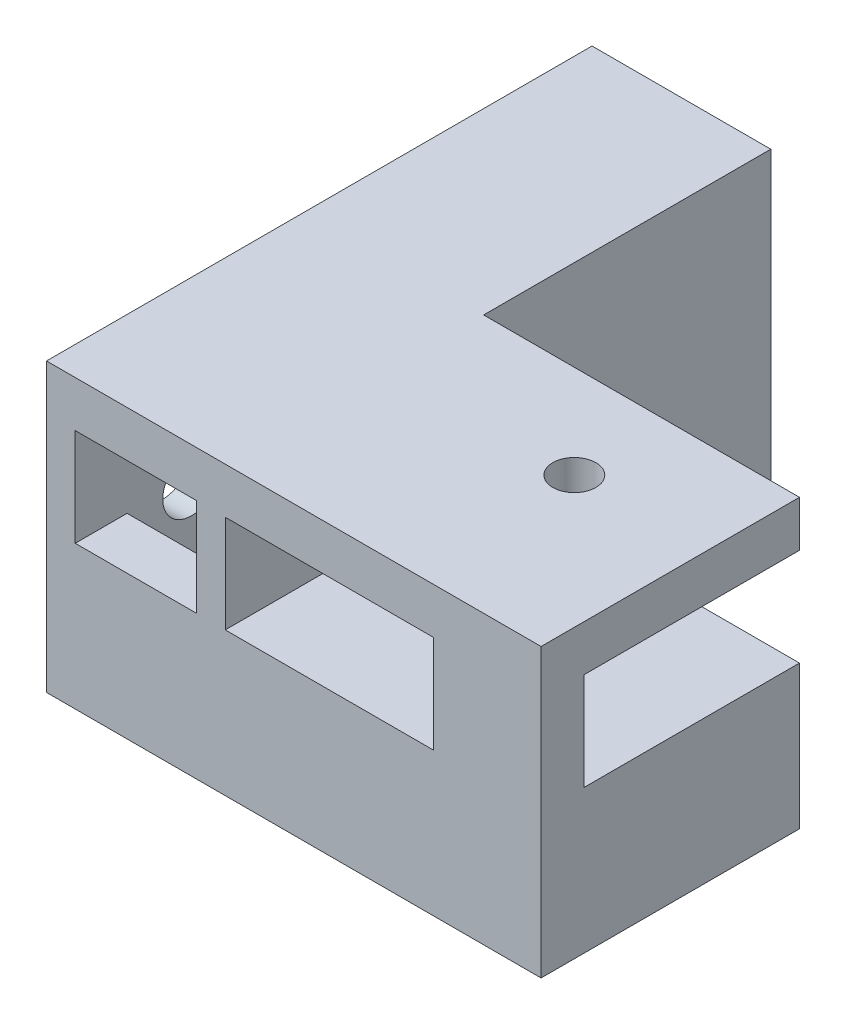
from build123d import *

# Parameters (mm, degrees)
SKETCH1_W             = 19
SKETCH1_H             = 10
BOSS_EXTRUDE1_DEPTH   = 18
SKETCH1_H_2           = 3.2
BOSS_EXTRUDE1_2_DEPTH = 18
SKETCH1_6_W           = 12.45
SKETCH1_6_H           = 3.2
BOSS_EXTRUDE6_DEPTH   = 38
BOSS_EXTRUDE7_DEPTH   = 10
SKETCH4_W             = 18
SKETCH4_H             = 10
SKETCH4_H_2           = 3.2
BOSS_EXTRUDE8_DEPTH   = 3
CUT_EXTRUDE1_START    = -10
SKETCH6_R             = 1.5
CUT_EXTRUDE1_DEPTH    = 20
BOSS_EXTRUDE10_REACH  = 45.922
SKETCH7_W             = 2
SKETCH7_H             = 38
BOSS_EXTRUDE11_REACH  = 47.95
SKETCH8_W             = 7.5
SKETCH8_H             = 3
SKETCH9_R             = 2
CUT_EXTRUDE2_DEPTH    = 2
CUT_EXTRUDE3_START    = -10.45
CUT_EXTRUDE3_DEPTH    = 8.45


# Read off the part's stored shape, not the designer's step: Cut-Extrude3
with BuildPart() as part:
    # Sketch1 → Boss-Extrude1 (new body)
    with BuildSketch(Plane.XY):
        with Locations((7.125, 0)):
            Rectangle(SKETCH1_W, SKETCH1_H)
    extrude(amount=-BOSS_EXTRUDE1_DEPTH)



with BuildPart() as body_2:
    # Sketch1 → Boss-Extrude1 2 (new body)
    with BuildSketch(Plane.XY):
        with Locations((7.125, 13.4)):
            Rectangle(SKETCH1_W, SKETCH1_H_2)
    extrude(amount=-BOSS_EXTRUDE1_2_DEPTH)


with BuildPart() as part_1:
    add(part.part)

    add(body_2.part)  # Boss-Extrude6 merges body 2
    # Sketch1<6> → Boss-Extrude6 (add)
    with BuildSketch(Plane.XY):
        Polygon((-14.825, 5), (-14.825, -2), (-9.825, -2), (-9.825, -5), (-2.375, -5), (-2.375, 5), align=None)
        with Locations((-8.6, 13.4)):
            Rectangle(SKETCH1_6_W, SKETCH1_6_H)
    extrude(amount=-BOSS_EXTRUDE6_DEPTH)

    # Sketch1<7> → Boss-Extrude7 (add)
    with BuildSketch(Plane.XY):
        Polygon((-14.825, -2), (-14.825, -3.3), (-14.825, -5), (-9.825, -5), (-9.825, -2), align=None)
    extrude(amount=-BOSS_EXTRUDE7_DEPTH)

    # Sketch4 → Boss-Extrude8 (add)
    with BuildSketch(Plane(origin=(16.625, 0, 0), x_dir=(0, 0, -1), z_dir=(1, 0, 0))):
        with Locations((9, 0)):
            Rectangle(SKETCH4_W, SKETCH4_H)
        with Locations((9, 13.4)):
            Rectangle(SKETCH4_W, SKETCH4_H_2)
    extrude(amount=BOSS_EXTRUDE8_DEPTH)

    # Sketch6 → Cut-Extrude1 (cut)
    with BuildSketch(Plane(origin=(0, 5, 0), x_dir=(1, 0, 0), z_dir=(0, 1, 0)).offset(CUT_EXTRUDE1_START)):
        with Locations(Location((10.44201924, 11.5, 0), (0, 0, 270))):
            Circle(SKETCH6_R)
    extrude(amount=CUT_EXTRUDE1_DEPTH, mode=Mode.SUBTRACT)

    # Sketch7 → Boss-Extrude10 (add, up to next)
    with BuildSketch(Plane(origin=(0, 5, 0), x_dir=(1, 0, 0), z_dir=(0, 1, 0)), mode=Mode.PRIVATE) as boss_extrude10_sk1:
        with Locations((-3.375, 19)):
            Rectangle(SKETCH7_W, SKETCH7_H)
    boss_extrude10_tool1 = extrude(boss_extrude10_sk1.sketch, amount=BOSS_EXTRUDE10_REACH, mode=Mode.PRIVATE) - part_1.part
    # Sketch7 → Boss-Extrude10 (add, up to next)
    with BuildSketch(Plane(origin=(0, 5, 0), x_dir=(1, 0, 0), z_dir=(0, 1, 0)), mode=Mode.PRIVATE) as boss_extrude10_sk2:
        with Locations((-13.825, 19)):
            Rectangle(SKETCH7_W, SKETCH7_H)
    boss_extrude10_tool2 = extrude(boss_extrude10_sk2.sketch, amount=BOSS_EXTRUDE10_REACH, mode=Mode.PRIVATE) - part_1.part
    add(boss_extrude10_tool1.solids().sort_by_distance((-3.375, 5, -19))[0])
    add(boss_extrude10_tool2.solids().sort_by_distance((-13.825, 5, -19))[0])

    # Sketch8 → Boss-Extrude11 (add, up to next)
    with BuildSketch(Plane.XZ.offset(-11.8), mode=Mode.PRIVATE) as boss_extrude11_sk1:
        with Locations((15.875, -1.5)):
            Rectangle(SKETCH8_W, SKETCH8_H)
    boss_extrude11_tool1 = extrude(boss_extrude11_sk1.sketch, amount=BOSS_EXTRUDE11_REACH, mode=Mode.PRIVATE) - part_1.part
    add(boss_extrude11_tool1.solids().sort_by_distance((15.875, 11.8, -1.5))[0])

    # Sketch9 → Cut-Extrude2 (cut)
    with BuildSketch(Plane.ZY.offset(14.825)):
        with Locations(Location((-8.095100141, 4.609535031, 0), (0, 0, 270))):
            Circle(SKETCH9_R)
    extrude(amount=-CUT_EXTRUDE2_DEPTH, mode=Mode.SUBTRACT)

    # Cut-Extrude3 outline → Cut-Extrude3 (cut)
    with BuildSketch(Plane.ZY.offset(14.825).offset(CUT_EXTRUDE3_START)):
        with BuildLine():
            Line((-3.612072469, 5), (-15.943641317, 5))
            Line((-15.943641317, 5), (-16.601615213, 4.609535031))
            Line((-16.601615213, 4.609535031), (-9.291615213, 0.271522619))
            ThreePointArc((-9.291615213, 0.271522619), (-5.215878744, 1.151199572), (-3.612072469, 5))
        make_face()
    extrude(amount=CUT_EXTRUDE3_DEPTH, mode=Mode.SUBTRACT)


solid = part_1.part
